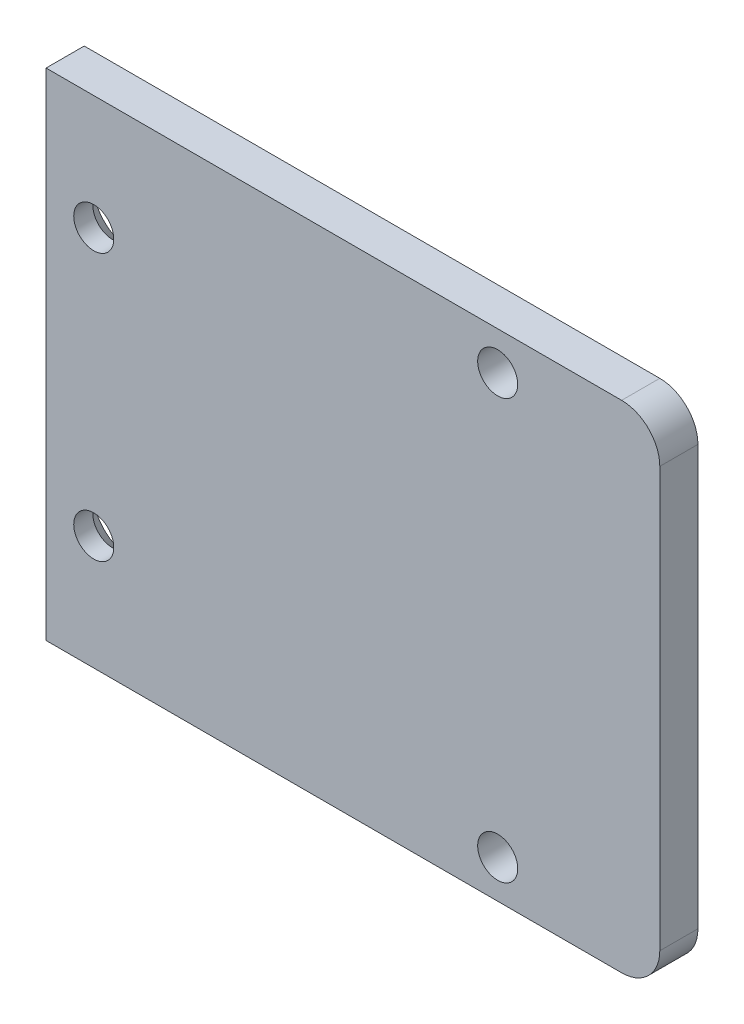
from build123d import *

# Parameters (mm, degrees)
SKETCH_2_W          = 32.183544672
SKETCH_2_H          = 26
EXTRUDE_1_DEPTH     = 2
FILLET_1_R          = 2
CUT_EXTRUDE_1_REACH = 38.671
SKETCH_3_R          = 1.05
CUT_EXTRUDE_2_REACH = 38.671
SKETCH_4_R          = 1.05
CHAMFER_1_SIZE      = 1


with BuildPart() as part:
    # 草图2 → 凸台-拉伸1 (new body)
    with BuildSketch(Plane.XY):
        with Locations((-0.901029093, -19.434236018)):
            Rectangle(SKETCH_2_W, SKETCH_2_H)
    extrude(amount=EXTRUDE_1_DEPTH)

    # 圆角1
    fillet_1_edges = [part.edges().sort_by_distance(p)[0] for p in [
        (15.190743243, -32.434236018, 1),
        (15.190743243, -6.434236018, 1),
    ]]
    fillet(fillet_1_edges, radius=FILLET_1_R)

    # 草图3 → 切除-拉伸1 (cut, up to next)
    with BuildSketch(Plane.XY.offset(2), mode=Mode.PRIVATE) as cut_extrude_1_sk1:
        with Locations((6.690743243, -8.434236018)):
            Circle(SKETCH_3_R)
    cut_extrude_1_tool1 = extrude(cut_extrude_1_sk1.sketch, amount=-CUT_EXTRUDE_1_REACH, mode=Mode.PRIVATE) & part.part
    # 草图3 → 切除-拉伸1 (cut, up to next)
    with BuildSketch(Plane.XY.offset(2), mode=Mode.PRIVATE) as cut_extrude_1_sk2:
        with Locations((6.690743243, -30.434236018)):
            Circle(SKETCH_3_R)
    cut_extrude_1_tool2 = extrude(cut_extrude_1_sk2.sketch, amount=-CUT_EXTRUDE_1_REACH, mode=Mode.PRIVATE) & part.part
    add(cut_extrude_1_tool1.solids().sort_by_distance((6.690743, -8.434236, 2))[0], mode=Mode.SUBTRACT)
    add(cut_extrude_1_tool2.solids().sort_by_distance((6.690743, -30.434236, 2))[0], mode=Mode.SUBTRACT)

    # 草图4 → 切除-拉伸2 (cut, up to next)
    with BuildSketch(Plane(origin=(0, 0, 0), x_dir=(-1, 0, 0), z_dir=(0, 0, -1)), mode=Mode.PRIVATE) as cut_extrude_2_sk1:
        with Locations((14.492801429, -12.434236018)):
            Circle(SKETCH_4_R)
    cut_extrude_2_tool1 = extrude(cut_extrude_2_sk1.sketch, amount=-CUT_EXTRUDE_2_REACH, mode=Mode.PRIVATE) & part.part
    # 草图4 → 切除-拉伸2 (cut, up to next)
    with BuildSketch(Plane(origin=(0, 0, 0), x_dir=(-1, 0, 0), z_dir=(0, 0, -1)), mode=Mode.PRIVATE) as cut_extrude_2_sk2:
        with Locations((14.492801429, -26.434236018)):
            Circle(SKETCH_4_R)
    cut_extrude_2_tool2 = extrude(cut_extrude_2_sk2.sketch, amount=-CUT_EXTRUDE_2_REACH, mode=Mode.PRIVATE) & part.part
    add(cut_extrude_2_tool1.solids().sort_by_distance((-14.492801, -12.434236, 0))[0], mode=Mode.SUBTRACT)
    add(cut_extrude_2_tool2.solids().sort_by_distance((-14.492801, -26.434236, 0))[0], mode=Mode.SUBTRACT)

    # 倒角1
    chamfer_1_edges = [part.edges().sort_by_distance(p)[0] for p in [
        (-13.442801429, -12.434236018, 0),
        (-13.442801429, -26.434236018, 0),
    ]]
    chamfer(chamfer_1_edges, length=CHAMFER_1_SIZE)


solid = part.part
